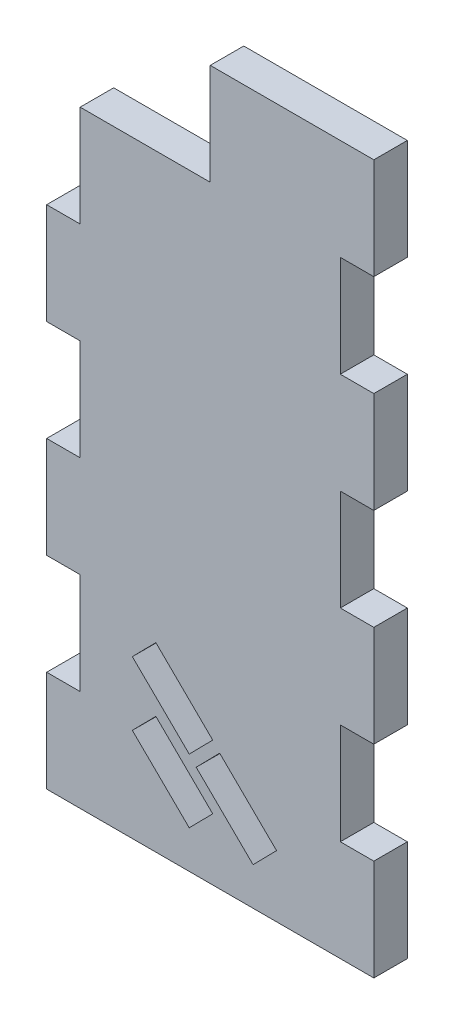
from build123d import *

# Parameters (mm, degrees)
SKETCH1_W           = 52.07
SKETCH1_H           = 112.776
BOSS_EXTRUDE1_DEPTH = 5.334
SKETCH2_W           = 5.334
SKETCH2_H           = 16.110857143
SKETCH2_H_2         = 16.110857142
CUT_EXTRUDE1_DEPTH  = 82.040197417
CUT_EXTRUDE2_DEPTH  = 82.040197417
SKETCH4_W           = 26.035
SKETCH4_H           = 16.110857143
CUT_EXTRUDE3_DEPTH  = 82.040197417


with BuildPart() as part:
    # Sketch1 → Boss-Extrude1 (new body)
    with BuildSketch(Plane.XY):
        with Locations((-13.887031982, -13.934780119)):
            Rectangle(SKETCH1_W, SKETCH1_H)
    extrude(amount=BOSS_EXTRUDE1_DEPTH)

    # Sketch2 → Cut-Extrude1 (cut, through all)
    with BuildSketch(Plane.XY.offset(5.334)):
        with Locations((-37.255031982, 18.286934167)):
            Rectangle(SKETCH2_W, SKETCH2_H)
        with Locations((-37.255031982, -13.93478012)):
            Rectangle(SKETCH2_W, SKETCH2_H)
        with Locations((-37.255031982, -46.156494405)):
            Rectangle(SKETCH2_W, SKETCH2_H_2)
        with Locations((9.480968018, -46.156494405)):
            Rectangle(SKETCH2_W, SKETCH2_H_2)
        with Locations((9.480968018, -13.93478012)):
            Rectangle(SKETCH2_W, SKETCH2_H)
        with Locations((9.480968018, 18.286934167)):
            Rectangle(SKETCH2_W, SKETCH2_H)
    extrude(amount=-CUT_EXTRUDE1_DEPTH, mode=Mode.SUBTRACT)

    # Sketch3 → Cut-Extrude2 (cut, through all)
    with BuildSketch(Plane.XY.offset(5.334)):
        Polygon((-22.544809753, -41.442678073), (-13.491049115, -50.348823048), (-17.231630005, -54.151402516), (-26.285390642, -45.245257541), align=None)
        Polygon((-22.544809753, -51.602678073), (-13.491049115, -60.508823048), (-17.231630005, -64.311402516), (-26.285390642, -55.405257541), align=None)
        Polygon((-12.384809753, -51.602678073), (-3.331049115, -60.508823048), (-7.071630005, -64.311402516), (-16.125390642, -55.405257541), align=None)
    extrude(amount=-CUT_EXTRUDE2_DEPTH, mode=Mode.SUBTRACT)

    # Sketch4 → Cut-Extrude3 (cut, through all)
    with BuildSketch(Plane.XY.offset(5.334)):
        with Locations((-26.904531982, 34.39779131)):
            Rectangle(SKETCH4_W, SKETCH4_H)
    extrude(amount=-CUT_EXTRUDE3_DEPTH, mode=Mode.SUBTRACT)


solid = part.part
